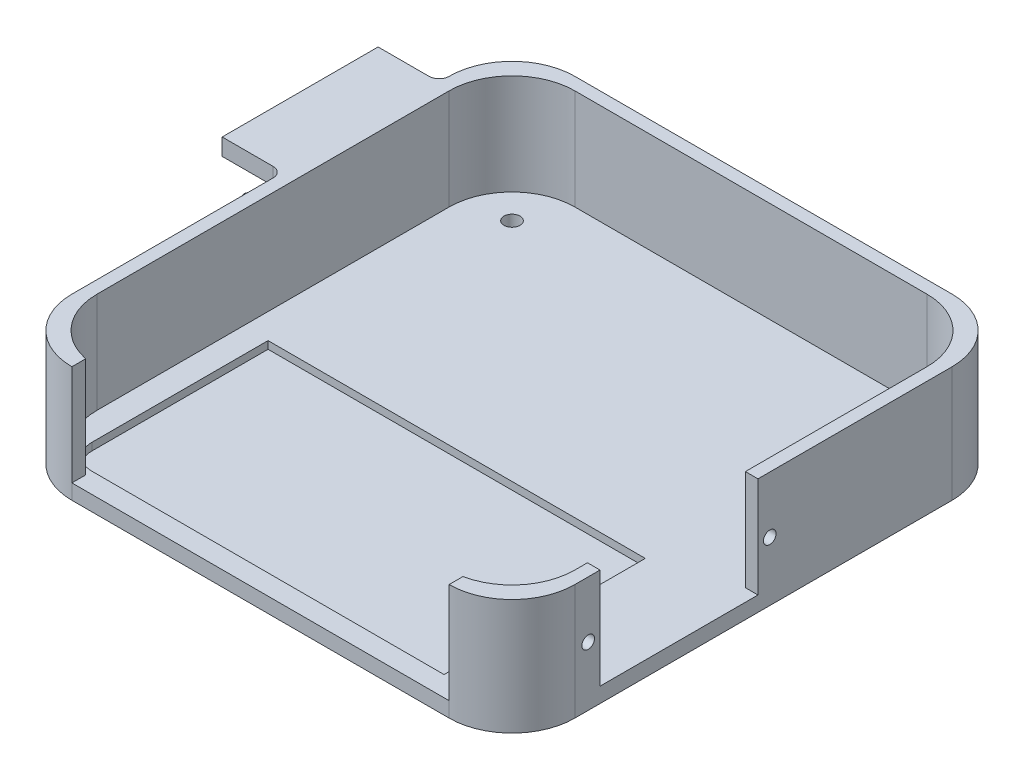
from build123d import *

# Parameters (mm, degrees)
BOSS_EXTRUDE1_DEPTH     = 23
BOSS_EXTRUDE2_DEPTH     = 3
CUT_EXTRUDE1_DEPTH      = 143.828568571
CUT_EXTRUDE1_DEPTH_BACK = 143.828568571
SKETCH4_R               = 1.6
CUT_EXTRUDE2_DEPTH      = 1.5
SKETCH6_W               = 75
SKETCH6_H               = 20
CUT_EXTRUDE4_DEPTH      = 5
SKETCH8_R               = 1.25
SKETCH8_W               = 31.4
SKETCH8_H               = 20
CUT_EXTRUDE5_DEPTH      = 5
SKETCH9_W               = 2
SKETCH9_H               = 4.5
BOSS_EXTRUDE3_DEPTH     = 10
FILLET2_R               = 1
SKETCH10_W              = 12.12
SKETCH10_H              = 31
BOSS_EXTRUDE4_DEPTH     = 2.6
FILLET3_R               = 2
FILLET5_R               = 2
SKETCH11_W              = 2
SKETCH11_H              = 24
BOSS_EXTRUDE5_DEPTH     = 4
FILLET6_R               = 1
FILLET7_R               = 1
SKETCH12_W              = 10.12
SKETCH12_H              = 2
BOSS_EXTRUDE6_DEPTH     = 0.75
FILLET3_OF_MIRROR1_R    = 2
FILLET5_OF_MIRROR1_R    = 2
FILLET6_OF_MIRROR1_R    = 1
FILLET7_OF_MIRROR1_R    = 1


with BuildPart() as part:
    # Sketch1 → Boss-Extrude1 (new body)
    with BuildSketch(Plane(origin=(0, 0, 0), x_dir=(1, 0, 0), z_dir=(0, 1, 0))):
        with BuildLine():
            Line((12.5, 0), (87.5, 0))
            ThreePointArc((87.5, 0), (96.338834765, 3.661165235), (100, 12.5))
            Line((100, 12.5), (100, 87.5))
            ThreePointArc((100, 87.5), (96.338834765, 96.338834765), (87.5, 100))
            Line((87.5, 100), (12.5, 100))
            ThreePointArc((12.5, 100), (3.661165235, 96.338834765), (0, 87.5))
            Line((0, 87.5), (0, 12.5))
            ThreePointArc((0, 12.5), (3.661165235, 3.661165235), (12.5, 0))
        make_face()
        with BuildLine():
            Line((15, 97.5), (85, 97.5))
            ThreePointArc((85, 97.5), (93.838834765, 93.838834765), (97.5, 85))
            Line((97.5, 85), (97.5, 15))
            ThreePointArc((97.5, 15), (93.838834765, 6.161165235), (85, 2.5))
            Line((85, 2.5), (15, 2.5))
            ThreePointArc((15, 2.5), (6.161165235, 6.161165235), (2.5, 15))
            Line((2.5, 15), (2.5, 85))
            ThreePointArc((2.5, 85), (6.161165235, 93.838834765), (15, 97.5))
        make_face(mode=Mode.SUBTRACT)
    extrude(amount=BOSS_EXTRUDE1_DEPTH)

    # Sketch1<2> → Boss-Extrude2 (add)
    with BuildSketch(Plane(origin=(0, 0, 0), x_dir=(1, 0, 0), z_dir=(0, 1, 0))):
        with BuildLine():
            Line((15, 97.5), (85, 97.5))
            ThreePointArc((85, 97.5), (93.838834765, 93.838834765), (97.5, 85))
            Line((97.5, 85), (97.5, 15))
            ThreePointArc((97.5, 15), (93.838834765, 6.161165235), (85, 2.5))
            Line((85, 2.5), (15, 2.5))
            ThreePointArc((15, 2.5), (6.161165235, 6.161165235), (2.5, 15))
            Line((2.5, 15), (2.5, 85))
            ThreePointArc((2.5, 85), (6.161165235, 93.838834765), (15, 97.5))
        make_face()
    extrude(amount=BOSS_EXTRUDE2_DEPTH)

    # Sketch4 → Cut-Extrude1 (cut, two sides: drawn at the far end of the back side and taken through both)
    with BuildSketch(Plane(origin=(0, 3, 0), x_dir=(1, 0, 0), z_dir=(0, 1, 0)).offset(-CUT_EXTRUDE1_DEPTH_BACK)):
        with Locations(Location((88.890872965, 11.109127035, 0), (0, 0, 270))):
            Circle(SKETCH4_R)
        with Locations(Location((11.109127035, 88.890872965, 0), (0, 0, 270))):
            Circle(SKETCH4_R)
    extrude(amount=CUT_EXTRUDE1_DEPTH + CUT_EXTRUDE1_DEPTH_BACK, mode=Mode.SUBTRACT)

    # Sketch5 → Cut-Extrude2 (cut)
    with BuildSketch(Plane(origin=(0, 3, 0), x_dir=(1, 0, 0), z_dir=(0, 1, 0))):
        with BuildLine():
            Line((82.5, 4), (12.5, 4))
            ThreePointArc((12.5, 4), (8.964466094, 5.464466094), (7.5, 9))
            Line((7.5, 9), (7.5, 44))
            Line((7.5, 44), (82.5, 44))
            Line((82.5, 44), (82.5, 4))
        make_face()
    extrude(amount=-CUT_EXTRUDE2_DEPTH, mode=Mode.SUBTRACT)

    # Sketch6 → Cut-Extrude4 (cut)
    with BuildSketch(Plane.XY):
        with Locations((50, 13)):
            Rectangle(SKETCH6_W, SKETCH6_H)
    extrude(amount=-CUT_EXTRUDE4_DEPTH, mode=Mode.SUBTRACT)

    # Sketch8 → Cut-Extrude5 (cut)
    with BuildSketch(Plane(origin=(100, 0, 0), x_dir=(0, 0, -1), z_dir=(1, 0, 0))):
        with Locations((15.15, 11.76333723)):
            Circle(SKETCH8_R)
        with Locations(Location((51.25, 11.76333723, 0), (0, 0, 180))):
            Circle(SKETCH8_R)
        with Locations((33.2, 13)):
            Rectangle(SKETCH8_W, SKETCH8_H)
    extrude(amount=-CUT_EXTRUDE5_DEPTH, mode=Mode.SUBTRACT)

    # Sketch9 → Boss-Extrude3 (add)
    with BuildSketch(Plane.ZY):
        with Locations((-56.5, 11.5)):
            Rectangle(SKETCH9_W, SKETCH9_H)
    extrude(amount=BOSS_EXTRUDE3_DEPTH)

    # Fillet2
    fillet2_edges = [part.edges().sort_by_distance(p)[0] for p in [
        (0, 11.5, -57.5),
        (-5, 13.75, -57.5),
        (0, 9.25, -56.5),
        (-5, 9.25, -57.5),
        (0, 11.5, -55.5),
        (-5, 9.25, -55.5),
        (0, 13.75, -56.5),
        (-5, 13.75, -55.5),
        (-10, 11.5, -57.5),
        (-10, 9.25, -56.5),
        (-10, 11.5, -55.5),
        (-10, 13.75, -56.5),
    ]]
    fillet(fillet2_edges, radius=FILLET2_R - 0.0001)  # a hair under: the kernel refuses the full size

    # Sketch10 → Boss-Extrude4 (add)
    with BuildSketch(Plane(origin=(0, 0, 0), x_dir=(1, 0, 0), z_dir=(0, 1, 0))):
        with Locations((-6.06, 70)):
            Rectangle(SKETCH10_W, SKETCH10_H)
    boss_extrude4 = extrude(amount=BOSS_EXTRUDE4_DEPTH)

    # Fillet3
    fillet3_edges = [part.edges().sort_by_distance(p)[0] for p in [
        (0, 1.3, -54.5),
    ]]
    fillet(fillet3_edges, radius=FILLET3_R)

    # Fillet5
    fillet5_edges = [part.edges().sort_by_distance(p)[0] for p in [
        (0, 1.3, -85.5),
    ]]
    fillet(fillet5_edges, radius=FILLET5_R - 0.0001)  # a hair under: the kernel refuses the full size

    # Sketch11 → Boss-Extrude5 (add)
    with BuildSketch(Plane(origin=(0, 2.6, 0), x_dir=(1, 0, 0), z_dir=(0, 1, 0))):
        with Locations((-11.12, 73.5)):
            Rectangle(SKETCH11_W, SKETCH11_H)
    boss_extrude5 = extrude(amount=BOSS_EXTRUDE5_DEPTH)

    # Fillet6
    fillet6_edges = [part.edges().sort_by_distance(p)[0] for p in [
        (-12.12, 6.6, -73.5),
    ]]
    fillet(fillet6_edges, radius=FILLET6_R)

    # Fillet7
    fillet7_edges = [part.edges().sort_by_distance(p)[0] for p in [
        (-10.12, 2.6, -73.5),
    ]]
    fillet(fillet7_edges, radius=FILLET7_R)

    # Sketch12 → Boss-Extrude6 (add)
    with BuildSketch(Plane(origin=(0, 2.6, 0), x_dir=(1, 0, 0), z_dir=(0, 1, 0))):
        with Locations((-7.06, 55.5)):
            Rectangle(SKETCH12_W, SKETCH12_H)
    boss_extrude6 = extrude(amount=BOSS_EXTRUDE6_DEPTH)

    # Mirror1: Boss-Extrude4, Boss-Extrude5, Boss-Extrude6 across plane
    add(boss_extrude4.mirror(Plane.ZX.offset(11.5)))
    add(boss_extrude5.mirror(Plane.ZX.offset(11.5)))
    add(boss_extrude6.mirror(Plane.ZX.offset(11.5)))

    # Fillet3 of Mirror1
    fillet3_of_mirror1_edges = [part.edges().sort_by_distance(p)[0] for p in [
        (0, 21.7, -54.5),
    ]]
    fillet(fillet3_of_mirror1_edges, radius=FILLET3_OF_MIRROR1_R)

    # Fillet5 of Mirror1
    fillet5_of_mirror1_edges = [part.edges().sort_by_distance(p)[0] for p in [
        (0, 21.7, -85.5),
    ]]
    fillet(fillet5_of_mirror1_edges, radius=FILLET5_OF_MIRROR1_R - 0.0001)  # a hair under: the kernel refuses the full size

    # Fillet6 of Mirror1
    fillet6_of_mirror1_edges = [part.edges().sort_by_distance(p)[0] for p in [
        (-12.12, 16.4, -73.5),
    ]]
    fillet(fillet6_of_mirror1_edges, radius=FILLET6_OF_MIRROR1_R)

    # Fillet7 of Mirror1
    fillet7_of_mirror1_edges = [part.edges().sort_by_distance(p)[0] for p in [
        (-10.12, 20.4, -73.5),
    ]]
    fillet(fillet7_of_mirror1_edges, radius=FILLET7_OF_MIRROR1_R)


solid = part.part
